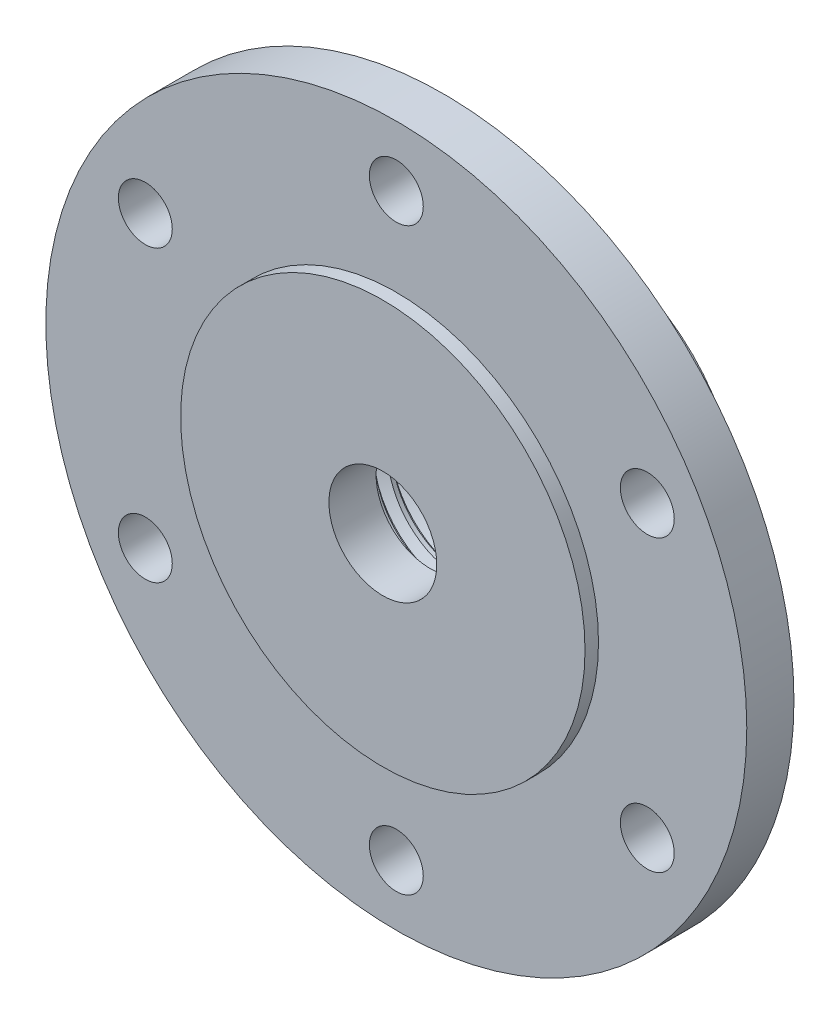
from build123d import *
from build123d.topology import SkipClean

# Parameters (mm, degrees)
SKETCH1_R           = 26
SKETCH1_R_2         = 2
BOSS_EXTRUDE1_DEPTH = 3.5
SKETCH2_R           = 15
BOSS_EXTRUDE2_DEPTH = 1
SKETCH3_R           = 12
BOSS_EXTRUDE3_DEPTH = 10
SKETCH4_R           = 6
CUT_EXTRUDE1_DEPTH  = 11
SKETCH5_R           = 4
CUT_EXTRUDE2_DEPTH  = 40.525308348
THREAD1_PITCH       = 1.25


with BuildPart() as part:
    # Sketch1 → Boss-Extrude1 (new body)
    with BuildSketch(Plane.XY):
        Circle(SKETCH1_R)
        with Locations((0, 21.5)):
            Circle(SKETCH1_R_2, mode=Mode.SUBTRACT)
        with Locations((18.619546181, 10.75)):
            Circle(SKETCH1_R_2, mode=Mode.SUBTRACT)
        with Locations((18.619546181, -10.75)):
            Circle(SKETCH1_R_2, mode=Mode.SUBTRACT)
        with Locations((0, -21.5)):
            Circle(SKETCH1_R_2, mode=Mode.SUBTRACT)
        with Locations((-18.619546181, -10.75)):
            Circle(SKETCH1_R_2, mode=Mode.SUBTRACT)
        with Locations((-18.619546181, 10.75)):
            Circle(SKETCH1_R_2, mode=Mode.SUBTRACT)
    extrude(amount=BOSS_EXTRUDE1_DEPTH)

    # Sketch2 → Boss-Extrude2 (add)
    with BuildSketch(Plane.XY.offset(3.5)):
        Circle(SKETCH2_R)
    extrude(amount=BOSS_EXTRUDE2_DEPTH)

    # Sketch3 → Boss-Extrude3 (add)
    with BuildSketch(Plane(origin=(0, 0, 0), x_dir=(-1, 0, 0), z_dir=(0, 0, -1))):
        with Locations(Location((0, 0, 0), (0, 0, 180))):
            Circle(SKETCH3_R)
    extrude(amount=BOSS_EXTRUDE3_DEPTH)

    # Sketch4 → Cut-Extrude1 (cut)
    with BuildSketch(Plane(origin=(0, 0, -10), x_dir=(-1, 0, 0), z_dir=(0, 0, -1))):
        Circle(SKETCH4_R)
    extrude(amount=-CUT_EXTRUDE1_DEPTH, mode=Mode.SUBTRACT)

    # Sketch5 → Cut-Extrude2 (cut, through all)
    with BuildSketch(Plane.XY.offset(4.5)):
        Circle(SKETCH5_R)
    extrude(amount=-CUT_EXTRUDE2_DEPTH, mode=Mode.SUBTRACT)

    # Thread1: the profile of Thread Profile1 profile screwed along a right-hand helix of 8.8 turns, 8 arcs to a turn; built about Z, then put on its axis
    with SkipClean():  # the faces are left unmerged after this step: merging them gives an invalid solid
        thread1_z = Axis((0, 0, 0), (0, 0, 1))
        thread1_corners = [(6.0003, 0, -0.000173205), (6.0003, 0, 1.093923202), (5.323417656, 0, 0.703124998), (5.323417656, 0, 0.390624998)]
        with BuildLine(mode=Mode.PRIVATE) as thread1_profile:
            Line(thread1_corners[0], thread1_corners[1])
            Line(thread1_corners[1], thread1_corners[2])
            Line(thread1_corners[2], thread1_corners[3])
            Line(thread1_corners[3], thread1_corners[0])
        thread1_cap = Face(thread1_profile.wire())
        thread1_turn_angles = [0, 22.5, 45, 67.5, 90, 112.5, 135, 157.5, 180, 202.5, 225, 247.5, 270, 292.5, 315, 337.5, 360]
        thread1_turn_weights = [1, 0.9238795325112867, 1, 0.9238795325112867, 1, 0.9238795325112867, 1, 0.9238795325112867, 1, 0.9238795325112867, 1, 0.9238795325112867, 1, 0.9238795325112867, 1, 0.9238795325112867, 1]
        thread1_turn_rails = [Edge.make_bspline([Vector(p[0], p[1], 0).rotate(thread1_z, thread1_turn_angles[k]) / thread1_turn_weights[k] + Vector(0, 0, p[2] + THREAD1_PITCH * thread1_turn_angles[k] / 360) for k in range(17)], [0, 0, 0, 1, 1, 2, 2, 3, 3, 4, 4, 5, 5, 6, 6, 7, 7, 8, 8, 8], 2, thread1_turn_weights) for p in thread1_corners]
        thread1_turn_sides = [Face.make_surface_from_curves(thread1_turn_rails[p[0]], thread1_turn_rails[p[1]]) for p in [(0, 1), (1, 2), (2, 3), (3, 0)]]
        thread1_last_angles = [2880, 2902.5, 2925, 2947.5, 2970, 2992.5, 3015, 3037.5, 3060, 3082.5, 3105, 3127.5, 3150, 3159, 3168]
        thread1_last_weights = [1, 0.9238795325112867, 1, 0.9238795325112867, 1, 0.9238795325112867, 1, 0.9238795325112867, 1, 0.9238795325112867, 1, 0.9238795325112867, 1, 0.9876883405951378, 1]
        thread1_last_rails = [Edge.make_bspline([Vector(p[0], p[1], 0).rotate(thread1_z, thread1_last_angles[k]) / thread1_last_weights[k] + Vector(0, 0, p[2] + THREAD1_PITCH * thread1_last_angles[k] / 360) for k in range(15)], [0, 0, 0, 1, 1, 2, 2, 3, 3, 4, 4, 5, 5, 6, 6, 7, 7, 7], 2, thread1_last_weights) for p in thread1_corners]
        thread1_last_sides = [Face.make_surface_from_curves(thread1_last_rails[p[0]], thread1_last_rails[p[1]]) for p in [(0, 1), (1, 2), (2, 3), (3, 0)]]
        thread1 = Plane(origin=(0, 0, -10), x_dir=(1, 0, 0), z_dir=(0, 0, 1)) * Solid(Shell([*[p.moved(Location((0, 0, THREAD1_PITCH * i))) for i in range(8) for p in thread1_turn_sides], *thread1_last_sides, thread1_cap, thread1_cap.rotate(thread1_z, 3168).moved(Location((0, 0, THREAD1_PITCH * 3168 / 360)))]))
        add(thread1)


solid = part.part
